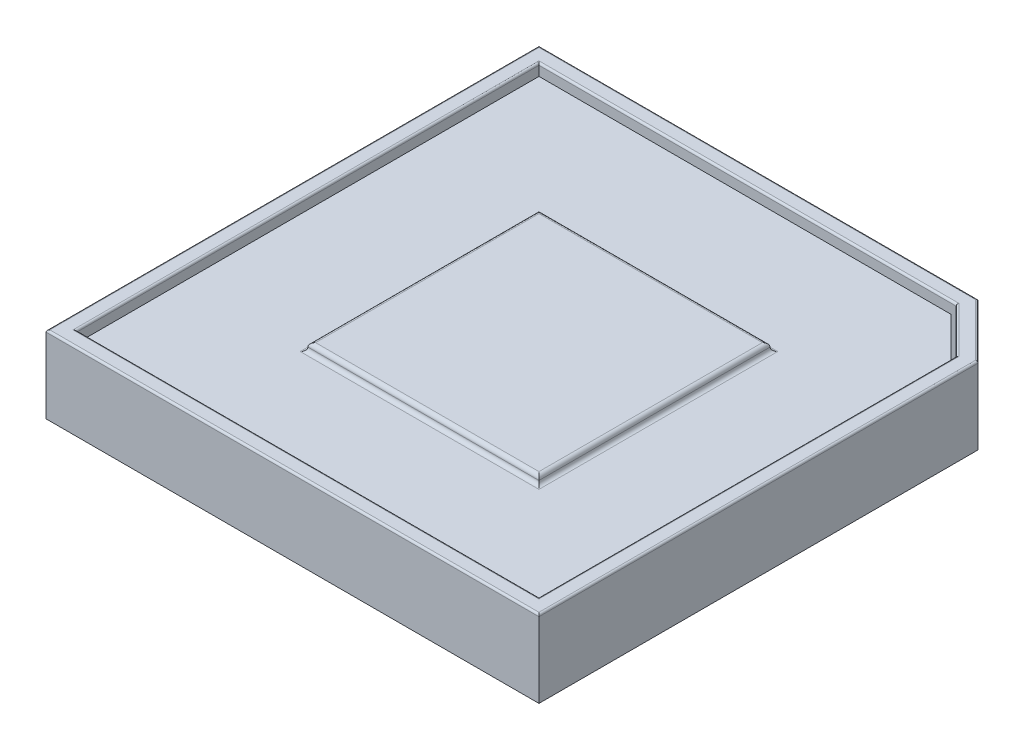
from build123d import *

# Parameters (mm, degrees)
BASE_EXTRUDE_DEPTH   = 5.08
CUT_EXTRUDE1_DEPTH   = 4.064
BOSS_EXTRUDE1_DEPTH  = 3.556
SKETCH4_W            = 15.24
SKETCH4_H            = 15.24
BOSS_EXTRUDE2_DEPTH  = 0.508
FILLET2_R            = 0.127
FILLET3_R            = 0.254
SKETCH5_R            = 0.3556
BOSS_EXTRUDE3_DEPTH  = 2.54
LPATTERN1_COUNT      = 10
LPATTERN1_PITCH      = 2.54
LPATTERN1_COUNT_DIR2 = 11
LPATTERN1_PITCH_DIR2 = 2.54
LPATTERN2_COUNT      = 2
LPATTERN2_PITCH      = 2.54
LPATTERN2_COUNT_DIR2 = 11
LPATTERN2_PITCH_DIR2 = 2.54


with BuildPart() as part:
    # Sketch1 → Base-Extrude (new body)
    with BuildSketch(Plane(origin=(0, 0, 0), x_dir=(1, 0, 0), z_dir=(0, 1, 0))):
        Polygon((0, 16.256), (3.556, 12.7), (3.556, -16.256), (-28.956, -16.256), (-28.956, 16.256), align=None)
    extrude(amount=BASE_EXTRUDE_DEPTH)

    # Sketch2 → Cut-Extrude1 (cut)
    with BuildSketch(Plane(origin=(0, 5.08, 0), x_dir=(-1, 0, 0), z_dir=(0, 1, 0))):
        Polygon((27.94, -15.24), (27.94, 15.24), (-2.54, 15.24), (-2.54, -12.279159021), (0.420840979, -15.24), align=None)
    extrude(amount=-CUT_EXTRUDE1_DEPTH, mode=Mode.SUBTRACT)

    # Sketch3 → Boss-Extrude1 (add)
    with BuildSketch(Plane(origin=(0, 1.016, 0), x_dir=(-1, 0, 0), z_dir=(0, 1, 0))):
        Polygon((0.526051224, -14.986), (27.686, -14.986), (27.686, 14.986), (-2.286, 14.986), (-2.286, -12.173948776), align=None)
    extrude(amount=BOSS_EXTRUDE1_DEPTH)

    # Sketch4 → Boss-Extrude2 (add)
    with BuildSketch(Plane(origin=(0, 4.572, 0), x_dir=(-1, 0, 0), z_dir=(0, 1, 0))):
        with Locations((11.971914099, 0.728085901)):
            Rectangle(SKETCH4_W, SKETCH4_H)
    extrude(amount=BOSS_EXTRUDE2_DEPTH)

    # Fillet2
    fillet2_edges = [part.edges().sort_by_distance(p)[0] for p in [
        (3.556, 5.08, 1.778),
        (1.778, 5.08, -14.478),
        (-14.478, 5.08, -16.256),
        (-14.18042049, 5.08, -15.24),
        (-27.94, 5.08, 0),
        (-12.7, 5.08, 15.24),
        (2.54, 5.08, 1.48042049),
        (1.05957951, 5.08, -13.75957951),
        (-28.956, 5.08, 0),
        (-12.7, 5.08, 16.256),
    ]]
    fillet(fillet2_edges, radius=FILLET2_R)

    # Fillet3
    fillet3_edges = [part.edges().sort_by_distance(p)[0] for p in [
        (-4.351914099, 4.572, 0.728085901),
        (-11.971914099, 4.572, -6.891914099),
        (-19.591914099, 4.572, 0.728085901),
        (-11.971914099, 4.572, 8.348085901),
        (-4.351914099, 5.08, 0.728085901),
        (-11.971914099, 5.08, -6.891914099),
        (-19.591914099, 5.08, 0.728085901),
        (-11.971914099, 5.08, 8.348085901),
    ]]
    fillet(fillet3_edges, radius=FILLET3_R - 0.0001)  # a hair under: the kernel refuses the full size

    # Sketch5 → Boss-Extrude3 (add)
    with BuildSketch(Plane.XZ):
        with Locations(Location((0, -10.541, 0), (0, 0, 90))):
            Circle(SKETCH5_R)
    boss_extrude3 = extrude(amount=BOSS_EXTRUDE3_DEPTH)

    # LPattern1: Boss-Extrude3 10 × 11, 51 skipped
    with Locations(*[(-j * LPATTERN1_PITCH_DIR2, 0, i * LPATTERN1_PITCH) for i in range(LPATTERN1_COUNT) for j in range(LPATTERN1_COUNT_DIR2) if (i, j) not in ((0, 0), (1, 2), (1, 3), (1, 4), (1, 5), (1, 6), (1, 7), (1, 8), (2, 2), (2, 3), (2, 4), (2, 5), (2, 6), (2, 7), (2, 8), (3, 2), (3, 3), (3, 4), (3, 5), (3, 6), (3, 7), (3, 8), (4, 2), (4, 3), (4, 4), (4, 5), (4, 6), (4, 7), (4, 8), (5, 2), (5, 3), (5, 4), (5, 5), (5, 6), (5, 7), (5, 8), (6, 2), (6, 3), (6, 4), (6, 5), (6, 6), (6, 7), (6, 8), (7, 2), (7, 3), (7, 4), (7, 5), (7, 6), (7, 7), (7, 8), (9, 0), (9, 10))]):
        add(boss_extrude3)

    # LPattern2: Boss-Extrude3 2 × 11, 2 skipped
    with Locations(*[(-j * LPATTERN2_PITCH_DIR2, 0, -i * LPATTERN2_PITCH) for i in range(LPATTERN2_COUNT) for j in range(LPATTERN2_COUNT_DIR2) if (i, j) not in ((0, 0), (1, 0), (1, 10))]):
        add(boss_extrude3)


solid = part.part
